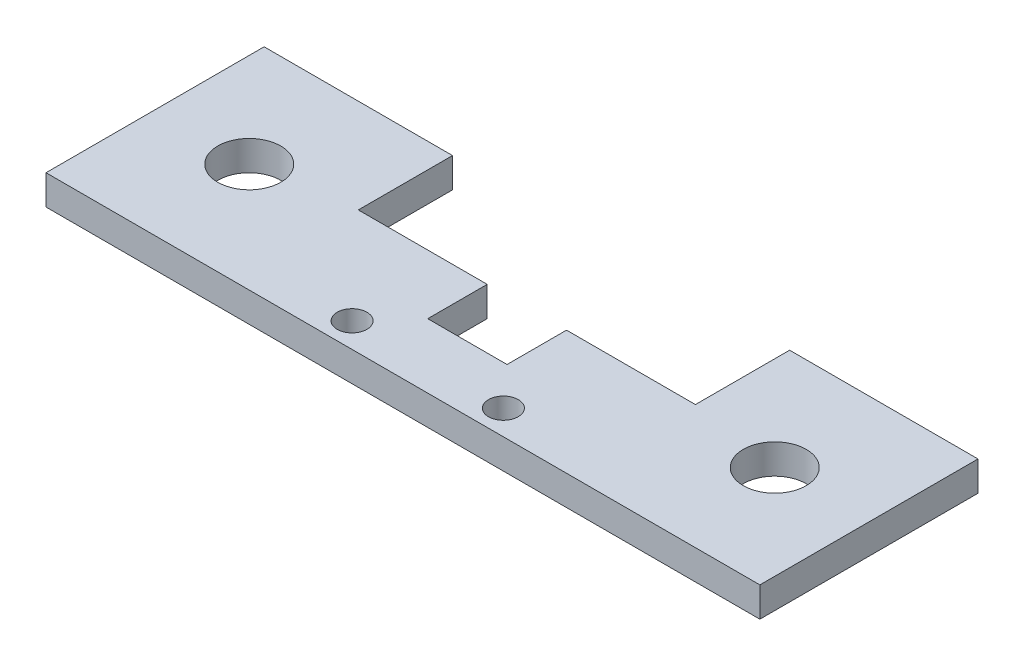
from build123d import *

# Parameters (mm, degrees)
SKETCH1_R           = 1.5
SKETCH1_R_2         = 3.175
BOSS_EXTRUDE1_DEPTH = 3


with BuildPart() as part:
    # Sketch1 → Boss-Extrude1 (new body)
    with BuildSketch(Plane(origin=(0, 0, 0), x_dir=(1, 0, 0), z_dir=(0, 1, 0))):
        Polygon((13, 0), (0, 0), (0, -6), (-8, -6), (-8, 0), (-21, 0), (-21, 9.5), (-40, 9.5), (-40, -12.5), (32, -12.5), (32, 9.5), (13, 9.5), align=None)
        with Locations((-11.63, -10)):
            Circle(SKETCH1_R, mode=Mode.SUBTRACT)
        with Locations((3.63, -10)):
            Circle(SKETCH1_R, mode=Mode.SUBTRACT)
        with Locations((22.5, -1.5)):
            Circle(SKETCH1_R_2, mode=Mode.SUBTRACT)
        with Locations((-30.5, -1.5)):
            Circle(SKETCH1_R_2, mode=Mode.SUBTRACT)
    extrude(amount=BOSS_EXTRUDE1_DEPTH)


solid = part.part
